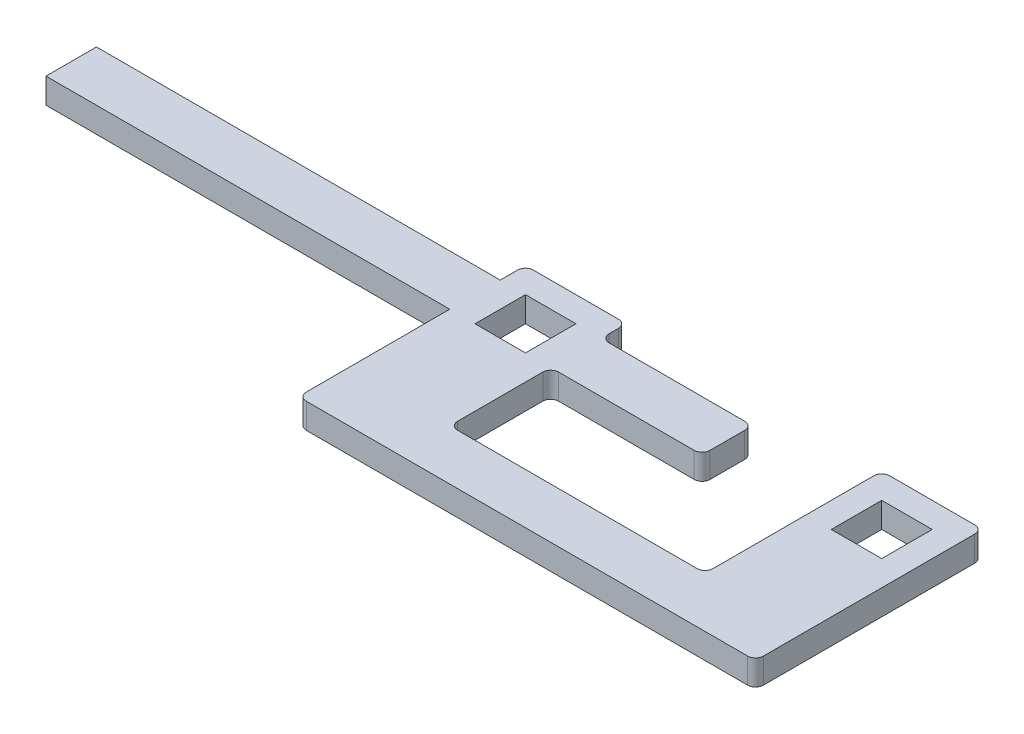
from build123d import *

# Parameters (mm, degrees)
SKETCH1_W              = 6.35
SKETCH1_H              = 6.35
ELASTIC_EXTRUDE_DEPTH  = 3.175
ELASTIC_CORNERFILLET_R = 1


with BuildPart() as part:
    # Sketch1 → Elastic_Extrude (new body)
    with BuildSketch(Plane(origin=(0, 0, 0), x_dir=(1, 0, 0), z_dir=(0, 1, 0))):
        Polygon((0, 0), (0, 19.05), (-50.8, 19.05), (-50.8, 25.4), (0, 25.4), (0, 28.575), (12.7, 28.575), (12.7, 25.4), (31.75, 25.4), (31.75, 19.05), (12.7, 19.05), (12.7, 6.35), (44.824904, 6.35), (44.824904, 28.575), (57.524904, 28.575), (57.524904, 0), (42.650000044, 0), (19.05, 0), align=None)
        with Locations((6.35, 22.225)):
            Rectangle(SKETCH1_W, SKETCH1_H, mode=Mode.SUBTRACT)
        with Locations((51.174904, 22.225)):
            Rectangle(SKETCH1_W, SKETCH1_H, mode=Mode.SUBTRACT)
    extrude(amount=ELASTIC_EXTRUDE_DEPTH)

    # Elastic_CornerFillet
    elastic_cornerfillet_edges = [part.edges().sort_by_distance(p)[0] for p in [
        (12.7, 1.5875, -6.35),
        (44.824904, 1.5875, -6.35),
        (44.824904, 1.5875, -28.575),
        (57.524904, 1.5875, -28.575),
        (57.524904, 1.5875, 0),
        (0, 1.5875, 0),
        (0, 1.5875, -28.575),
        (12.7, 1.5875, -19.05),
        (31.75, 1.5875, -19.05),
        (31.75, 1.5875, -25.4),
        (12.7, 1.5875, -25.4),
        (12.7, 1.5875, -28.575),
    ]]
    fillet(elastic_cornerfillet_edges, radius=ELASTIC_CORNERFILLET_R)


solid = part.part
